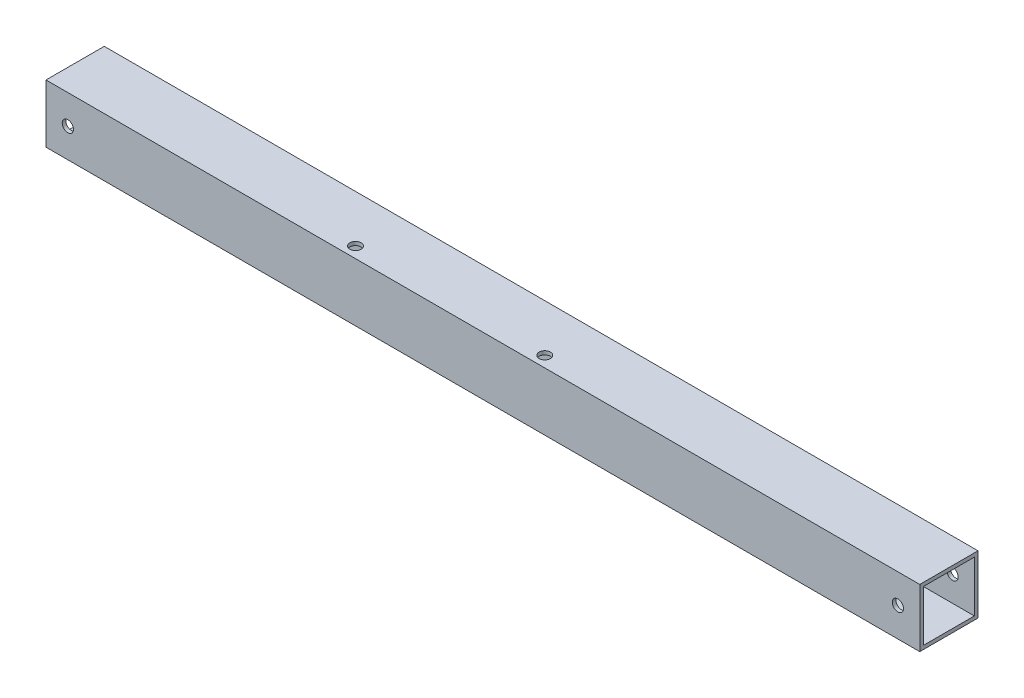
from build123d import *

# Parameters (mm, degrees)
SKETCH1_W                    = 25.4
SKETCH1_H                    = 25.4
SKETCH1_W_2                  = 22.225
SKETCH1_H_2                  = 22.225
EXTRUDE_THIN1_DEPTH          = 381
F_10_0_1935_DIAMETER_HOLE1_D = 4.9149
F_10_0_1935_DIAMETER_HOLE2_D = 4.9149


with BuildPart() as part:
    # Sketch1 → Extrude-Thin1 (new body)
    with BuildSketch(Plane(origin=(0, 0, 0), x_dir=(0, 0, -1), z_dir=(1, 0, 0))):
        Rectangle(SKETCH1_W, SKETCH1_H)
        Rectangle(SKETCH1_W_2, SKETCH1_H_2, mode=Mode.SUBTRACT)
    extrude(amount=EXTRUDE_THIN1_DEPTH)

    # #10 (0.1935) Diameter Hole1 (through all)
    with Locations(Plane.XY.offset(12.7)):
        with Locations((9.525, 0), (371.475, 0)):
            Hole(F_10_0_1935_DIAMETER_HOLE1_D / 2)

    # #10 (0.1935) Diameter Hole2 (through all)
    with Locations(Plane(origin=(0, 12.7, 0), x_dir=(1, 0, 0), z_dir=(0, 1, 0))):
        with Locations((130.175, -7.9375), (212.725, -7.9375)):
            Hole(F_10_0_1935_DIAMETER_HOLE2_D / 2)


solid = part.part
